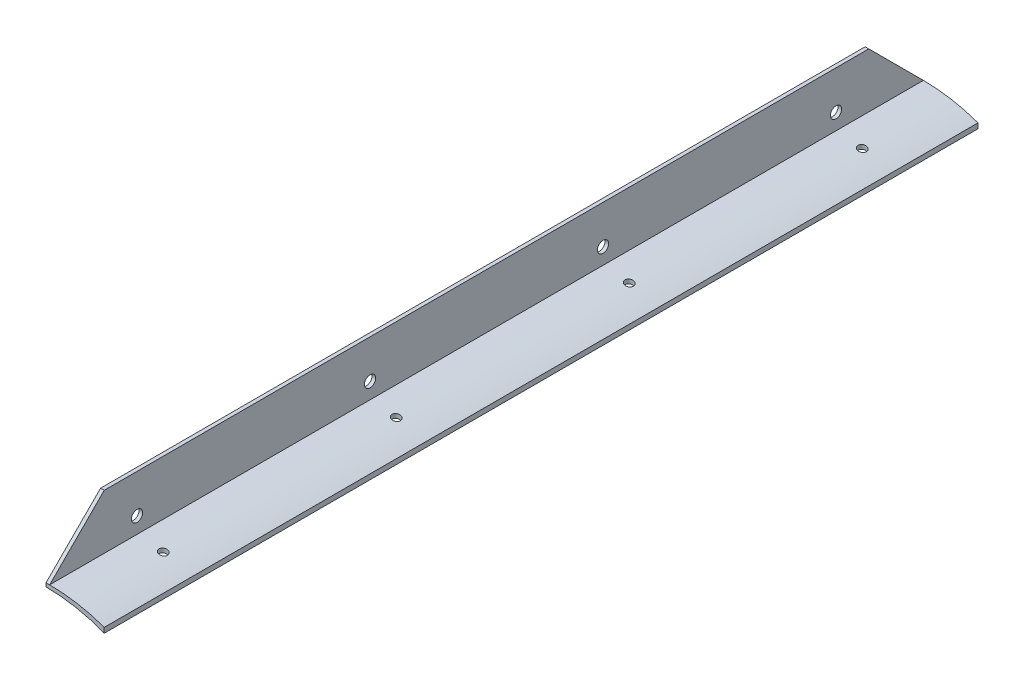
from build123d import *

# Parameters (mm, degrees)
EXTRUDE1_DEPTH               = 190.5
EXTRUDE2_DEPTH               = 387.35
F_6_CLEARANCE_HOLE1_D        = 3.6576
F_10_0_1935_DIAMETER_HOLE1_D = 4.9149
LPATTERN1_COUNT              = 3
LPATTERN1_PITCH              = 101.6
LPATTERN1_COUNT_DIR2         = 2
LPATTERN1_PITCH_DIR2         = 101.6


with BuildPart() as part:
    # Sketch1 → Extrude1 (new, symmetric)
    with BuildSketch(Plane.XY):
        with BuildLine():
            Line((0, 0), (0, 25.4))
            Line((0, 25.4), (1.5875, 25.4))
            Line((1.5875, 25.4), (1.5875, 1.5875))
            ThreePointArc((1.5875, 1.5875), (13.671867582, 0.546246178), (25.4, -2.546820159))
            Line((25.4, -2.546820159), (25.4, -4.781862636))
            ThreePointArc((25.4, -4.781862636), (12.923101507, -1.205874633), (0, 0))
        make_face()
    extrude(amount=EXTRUDE1_DEPTH, both=True)

    # Sketch2 → Extrude2 (cut)
    with BuildSketch(Plane.ZY):
        Polygon((190.5, 25.4), (166.6875, 25.4), (190.5, 1.5875), align=None)
    extrude2 = extrude(amount=-EXTRUDE2_DEPTH, mode=Mode.SUBTRACT)

    # Mirror2: Extrude2 across plane
    add(extrude2.mirror(Plane(origin=(0, 0, 0), x_dir=(1, 0, 0), z_dir=(0, 0, -1))), mode=Mode.SUBTRACT)

    # #6 Clearance Hole1 (through all)
    with Locations(Plane(origin=(0, 1.5875, 0), x_dir=(-1, 0, 0), z_dir=(0, 1, 0))):
        with Locations((-13.0175, -50.8)):
            f_6_clearance_hole1 = Hole(F_6_CLEARANCE_HOLE1_D / 2)

    # #10 (0.1935) Diameter Hole1 (through all)
    with Locations(Plane(origin=(1.5875, 8.5725, -50.8), x_dir=(0, 1, 0), z_dir=(1, 0, 0))):
        with Locations((0, 0)):
            f_10_0_1935_diameter_hole1 = Hole(F_10_0_1935_DIAMETER_HOLE1_D / 2)

    # LPattern1: #6 Clearance Hole1, 10 _0.1935_ Diameter Hole1 3 × 2
    with Locations(*[Vector(0, 0, 1) * (i * LPATTERN1_PITCH) + Vector(0, 0, -1) * (j * LPATTERN1_PITCH_DIR2) for i in range(LPATTERN1_COUNT) for j in range(LPATTERN1_COUNT_DIR2) if (i, j) != (0, 0)]):
        add(f_6_clearance_hole1, mode=Mode.SUBTRACT)
        add(f_10_0_1935_diameter_hole1, mode=Mode.SUBTRACT)


solid = part.part
